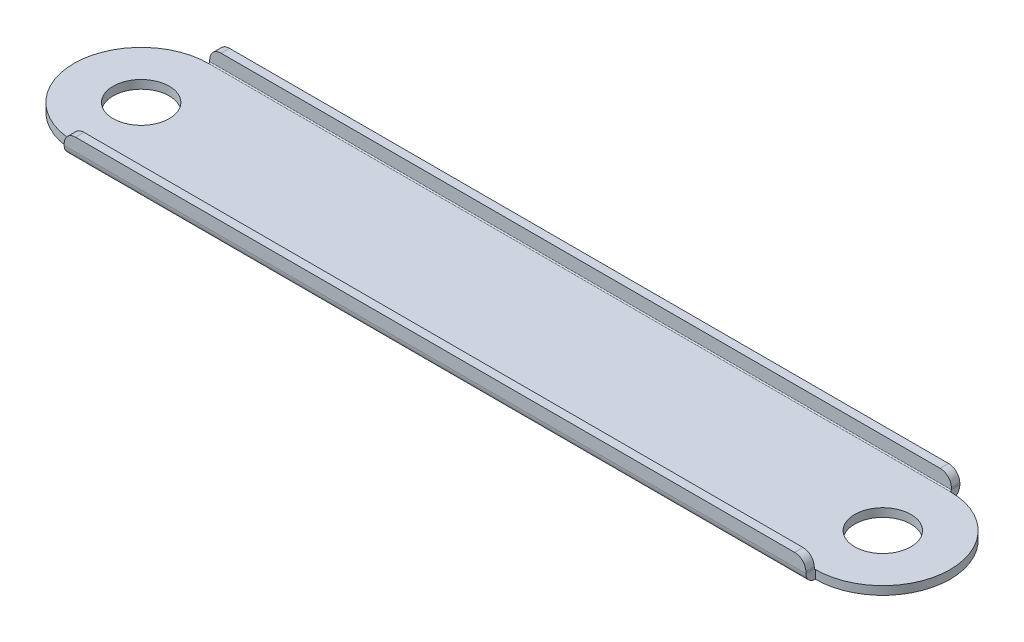
from build123d import *

# Parameters (mm, degrees)
SKETCH2_R               = 2.5
BASE_FLANGE1_DEPTH      = 0.75
EDGE_FLANGE1_DEPTH      = 66.001893912
EDGE_FLANGE1_BEND_DEPTH = 66.001893912
BREAK_CORNER1_START     = -6.85
BREAK_CORNER1_DEPTH     = 13.7


# Read off the part's stored shape, not the designer's step: Break-Corner1
# Sheet-metal steps are written as plain solids
with BuildPart() as part:
    # Sketch2 → Base-Flange1 (new body)
    with BuildSketch(Plane(origin=(0, 0, 0), x_dir=(1, 0, 0), z_dir=(0, 1, 0))):
        with BuildLine():
            Line((-33.000946956, 6), (33.000946956, 6))
            ThreePointArc((33.000946956, 6), (39.000946956, 0), (33.000946956, -6))
            Line((33.000946956, -6), (-33.000946956, -6))
            ThreePointArc((-33.000946956, -6), (-39.000946956, 0), (-33.000946956, 6))
        make_face()
        with Locations(Location((33.000946956, 0, 0), (0, 0, 270))):
            Circle(SKETCH2_R, mode=Mode.SUBTRACT)
        with Locations(Location((-33.000946956, 0, 0), (0, 0, 270))):
            Circle(SKETCH2_R, mode=Mode.SUBTRACT)
    extrude(amount=-BASE_FLANGE1_DEPTH)

    # Edge-Flange1 section (across the edge) → Edge-Flange1 (add)
    with BuildSketch(Plane(origin=(-33.000946956, 0, 6.1), x_dir=(0, 0, -1), z_dir=(1, 0, 0))):
        with BuildLine():
            Line((-0.75, 0.1), (-0.75, 1.25))
            Line((-0.75, 1.25), (0, 1.25))
            Line((0, 1.25), (0, 0.1))
            ThreePointArc((0, 0.1), (0.029289322, 0.029289322), (0.1, 0))
            Line((0.1, 0), (0.1, -0.75))
            ThreePointArc((0.1, -0.75), (-0.501040764, -0.501040764), (-0.75, 0.1))
        make_face()
    extrude(amount=EDGE_FLANGE1_DEPTH)

    # Edge-Flange1 section 2 (across the edge) → Edge-Flange1 bend (add)
    with BuildSketch(Plane(origin=(33.000946956, 0, -6.1), x_dir=(0, 0, 1), z_dir=(-1, 0, 0))):
        with BuildLine():
            Line((-0.75, 0.1), (-0.75, 1.25))
            Line((-0.75, 1.25), (0, 1.25))
            Line((0, 1.25), (0, 0.1))
            ThreePointArc((0, 0.1), (0.029289322, 0.029289322), (0.1, 0))
            Line((0.1, 0), (0.1, -0.75))
            ThreePointArc((0.1, -0.75), (-0.501040764, -0.501040764), (-0.75, 0.1))
        make_face()
    extrude(amount=EDGE_FLANGE1_BEND_DEPTH)

    # Break-Corner1 outline → Break-Corner1 (cut)
    with BuildSketch(Plane.XY.offset(BREAK_CORNER1_START)):
        with BuildLine():
            ThreePointArc((-33.000946956, 0.25), (-32.708053737, 0.957106781), (-32.000946956, 1.25))
            Line((-32.000946956, 1.25), (-33.000946956, 1.25))
            Line((-33.000946956, 1.25), (-33.000946956, 0.25))
        make_face()
        with BuildLine():
            ThreePointArc((32.000946956, 1.25), (32.708053737, 0.957106781), (33.000946956, 0.25))
            Line((33.000946956, 0.25), (33.000946956, 1.25))
            Line((33.000946956, 1.25), (32.000946956, 1.25))
        make_face()
    extrude(amount=BREAK_CORNER1_DEPTH, mode=Mode.SUBTRACT)


solid = part.part
